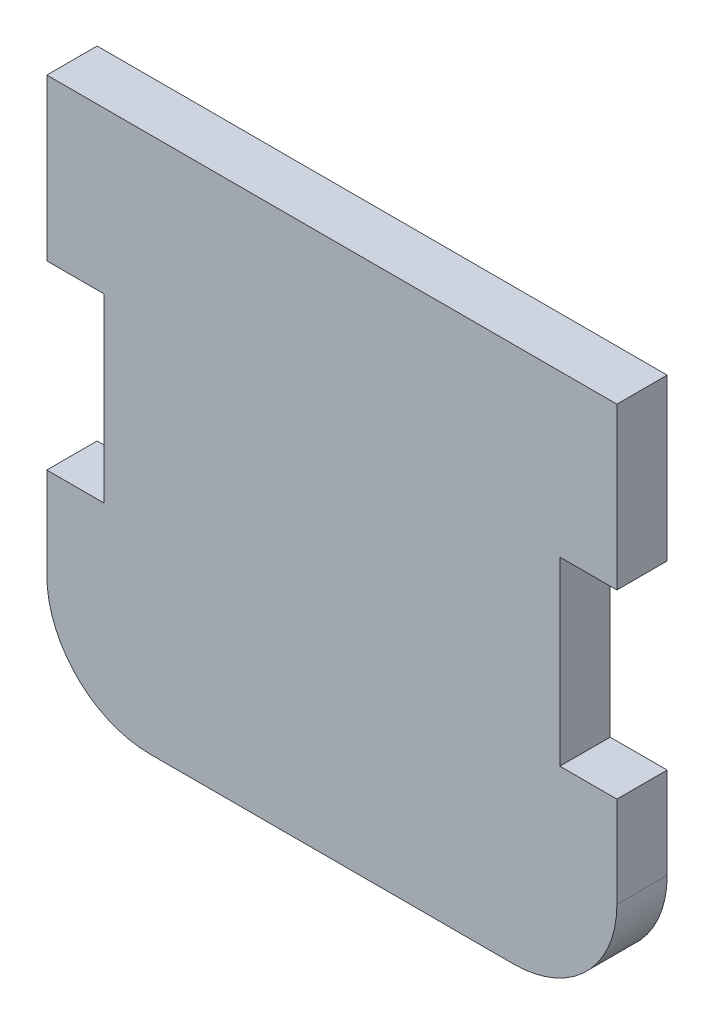
from build123d import *

# Parameters (mm, degrees)
BOSS_EXTRUDE1_DEPTH = 1.905
SKETCH2_W           = 2.413
SKETCH2_H           = 6.858
CUT_EXTRUDE1_DEPTH  = 455.166298817


with BuildPart() as part:
    # Sketch1 → Boss-Extrude1 (new body)
    with BuildSketch(Plane.XY):
        with BuildLine():
            Line((-434.0225, 0), (-432.1175, 0))
            Line((-432.1175, 0), (-432.1175, -6.35))
            Line((-432.1175, -6.35), (-432.1175, -12.7))
            Line((-432.1175, -12.7), (-432.1175, -16.4084))
            ThreePointArc((-432.1175, -16.4084), (-433.263181115, -19.174318885), (-436.0291, -20.32))
            Line((-436.0291, -20.32), (-449.7959, -20.32))
            ThreePointArc((-449.7959, -20.32), (-452.561818885, -19.174318885), (-453.7075, -16.4084))
            Line((-453.7075, -16.4084), (-453.7075, -12.7))
            Line((-453.7075, -12.7), (-453.7075, -6.35))
            Line((-453.7075, -6.35), (-453.7075, 0))
            Line((-453.7075, 0), (-451.8025, 0))
            Line((-451.8025, 0), (-434.0225, 0))
        make_face()
    extrude(amount=BOSS_EXTRUDE1_DEPTH)

    # Sketch2 → Cut-Extrude1 (cut, through all)
    with BuildSketch(Plane.XY.offset(1.905)):
        with Locations((-433.07, -9.525)):
            Rectangle(SKETCH2_W, SKETCH2_H)
        with Locations((-452.755, -9.525)):
            Rectangle(SKETCH2_W, SKETCH2_H)
    extrude(amount=-CUT_EXTRUDE1_DEPTH, mode=Mode.SUBTRACT)


solid = part.part
